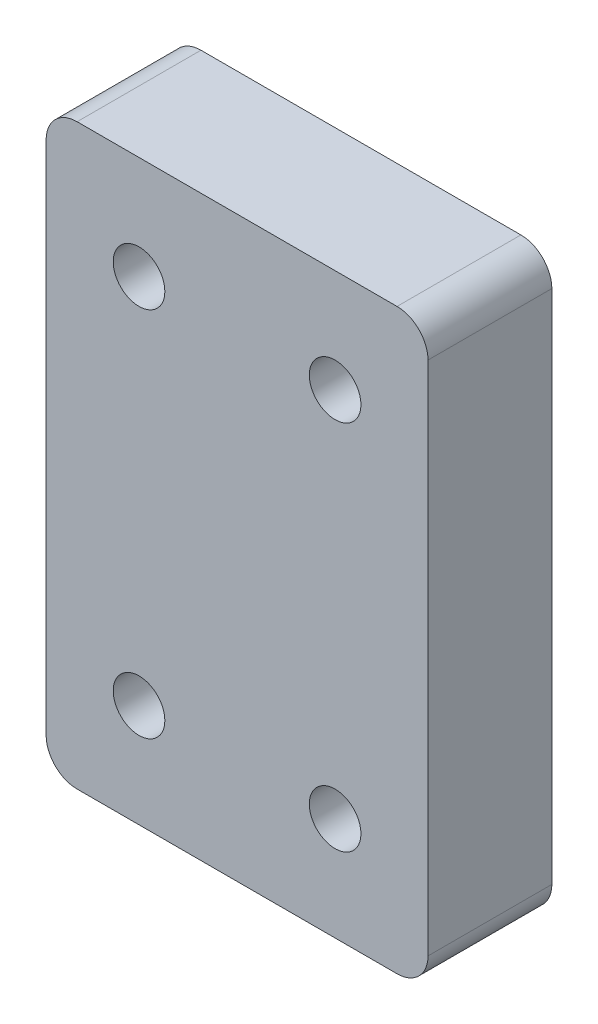
from build123d import *

# Parameters (mm, degrees)
BOSS_EXTRUDE1_DEPTH = 12
SKETCH2_R           = 2.5
CUT_EXTRUDE1_DEPTH  = 4


with BuildPart() as part:
    # Sketch1 → Boss-Extrude1 (new body)
    with BuildSketch(Plane.XY):
        with BuildLine():
            Line((-15.5, -28), (15.5, -28))
            ThreePointArc((15.5, -28), (17.621320344, -27.121320344), (18.5, -25))
            Line((18.5, -25), (18.5, 25))
            ThreePointArc((18.5, 25), (17.621320344, 27.121320344), (15.5, 28))
            Line((15.5, 28), (-15.5, 28))
            ThreePointArc((-15.5, 28), (-17.621320344, 27.121320344), (-18.5, 25))
            Line((-18.5, 25), (-18.5, -25))
            ThreePointArc((-18.5, -25), (-17.621320344, -27.121320344), (-15.5, -28))
        make_face()
    extrude(amount=BOSS_EXTRUDE1_DEPTH)

    # Sketch2 → Cut-Extrude1 (cut)
    with BuildSketch(Plane.XY.offset(12)):
        with Locations((-9.5, 18)):
            Circle(SKETCH2_R)
        with Locations((-9.5, -18)):
            Circle(SKETCH2_R)
        with Locations((9.5, -18)):
            Circle(SKETCH2_R)
        with Locations((9.5, 18)):
            Circle(SKETCH2_R)
    extrude(amount=-CUT_EXTRUDE1_DEPTH, mode=Mode.SUBTRACT)


solid = part.part
